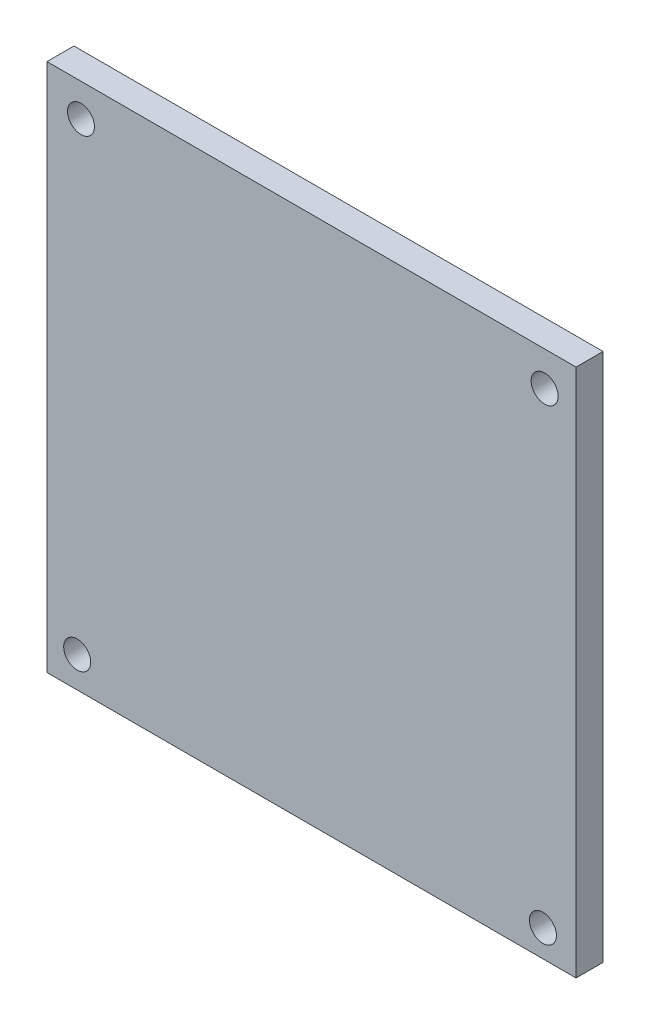
from build123d import *

# Parameters (mm, degrees)
SKETCH1_W           = 49.784
SKETCH1_H           = 49.784
BOSS_EXTRUDE1_DEPTH = 2.54
SKETCH2_R           = 1.27
CUT_EXTRUDE1_DEPTH  = 36.294120304


with BuildPart() as part:
    # Sketch1 → Boss-Extrude1 (new body)
    with BuildSketch(Plane.XY):
        Rectangle(SKETCH1_W, SKETCH1_H)
    extrude(amount=BOSS_EXTRUDE1_DEPTH)

    # Sketch2 → Cut-Extrude1 (cut, through all)
    with BuildSketch(Plane.XY.offset(2.54)):
        with Locations((-22.0472, -22.003711907)):
            Circle(SKETCH2_R)
        with Locations((-21.688499139, 21.818469938)):
            Circle(SKETCH2_R)
        with Locations((21.774981845, -22.362412768)):
            Circle(SKETCH2_R)
        with Locations((21.934472809, 21.661343147)):
            Circle(SKETCH2_R)
    extrude(amount=-CUT_EXTRUDE1_DEPTH, mode=Mode.SUBTRACT)


solid = part.part
